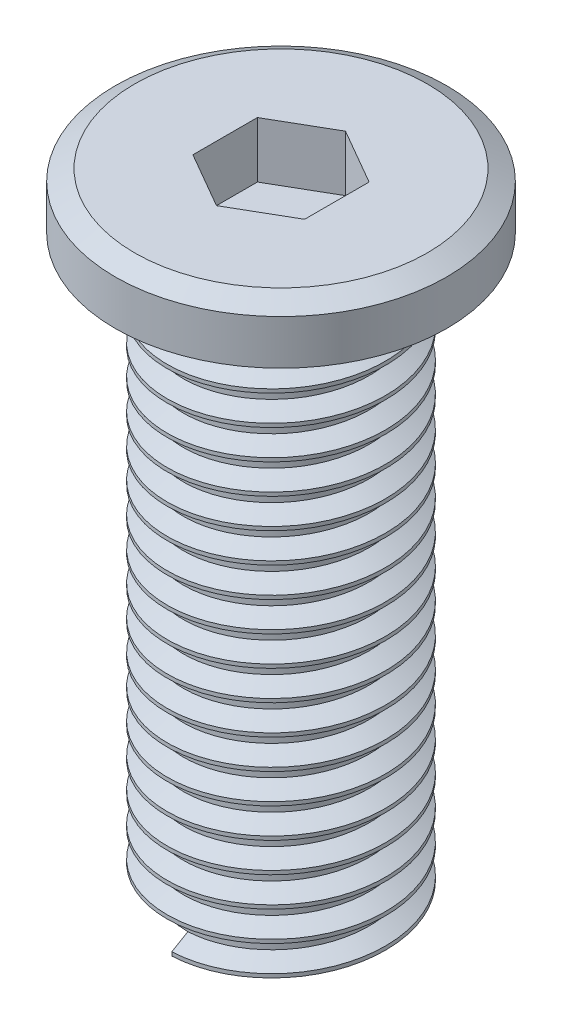
from build123d import *
from build123d.topology import SkipClean

# Parameters (mm, degrees)
SKETCH1_R           = 4.45
BOSS_EXTRUDE1_DEPTH = 1.5
CHAMFER2_SIZE       = 0.3
CHAMFER2_SIZE2      = 0.519615242
CUT_EXTRUDE1_DEPTH  = 3
SKETCH3_R           = 2.5
BOSS_EXTRUDE2_DEPTH = 15
THREAD1_PITCH       = 0.8


with BuildPart() as part:
    # Sketch1 → Boss-Extrude1 (new body)
    with BuildSketch(Plane(origin=(0, 0, 0), x_dir=(1, 0, 0), z_dir=(0, 1, 0))):
        with Locations(Location((0, 0, 0), (0, 0, 270))):
            Circle(SKETCH1_R)
    extrude(amount=BOSS_EXTRUDE1_DEPTH)

    # Chamfer2
    chamfer2_edges = [part.edges().sort_by_distance(p)[0] for p in [
        (0, 1.5, -4.45),
    ]]
    chamfer2_side = [part.faces().sort_by_distance(p)[0] for p in [
        (0, 0.75, -4.45),
    ]]
    chamfer(chamfer2_edges, length=CHAMFER2_SIZE, length2=CHAMFER2_SIZE2, reference=chamfer2_side[0])

    # Sketch8 → Cut-Extrude1 (cut)
    with BuildSketch(Plane(origin=(0, 1.5, 0), x_dir=(1, 0, 0), z_dir=(0, 1, 0))):
        Polygon((0, 1.732050808), (-1.5, 0.866025404), (-1.5, -0.866025404), (0, -1.732050808), (1.5, -0.866025404), (1.5, 0.866025404), align=None)
    extrude(amount=-CUT_EXTRUDE1_DEPTH, mode=Mode.SUBTRACT)

    # Sketch3 → Boss-Extrude2 (add)
    with BuildSketch(Plane.XZ):
        with Locations(Location((0, 0, 0), (0, 0, 90))):
            Circle(SKETCH3_R)
    extrude(amount=BOSS_EXTRUDE2_DEPTH)

    # Thread1: the profile of Thread Profile2 profile screwed along a right-hand helix of 18.75 turns, 8 arcs to a turn; built about Z, then put on its axis
    with SkipClean():  # the faces are left unmerged after this step: merging them gives an invalid solid
        thread1_z = Axis((0, 0, 0), (0, 0, 1))
        thread1_corners = [(2.4997, 0, -0.000173205), (2.9330127, 0, 0.249999999), (2.9330127, 0, 0.349999999), (2.4997, 0, 0.600173203)]
        with BuildLine(mode=Mode.PRIVATE) as thread1_profile:
            Line(thread1_corners[0], thread1_corners[1])
            Line(thread1_corners[1], thread1_corners[2])
            Line(thread1_corners[2], thread1_corners[3])
            Line(thread1_corners[3], thread1_corners[0])
        thread1_cap = Face(thread1_profile.wire())
        thread1_turn_angles = [0, 22.5, 45, 67.5, 90, 112.5, 135, 157.5, 180, 202.5, 225, 247.5, 270, 292.5, 315, 337.5, 360]
        thread1_turn_weights = [1, 0.9238795325112867, 1, 0.9238795325112867, 1, 0.9238795325112867, 1, 0.9238795325112867, 1, 0.9238795325112867, 1, 0.9238795325112867, 1, 0.9238795325112867, 1, 0.9238795325112867, 1]
        thread1_turn_rails = [Edge.make_bspline([Vector(p[0], p[1], 0).rotate(thread1_z, thread1_turn_angles[k]) / thread1_turn_weights[k] + Vector(0, 0, p[2] + THREAD1_PITCH * thread1_turn_angles[k] / 360) for k in range(17)], [0, 0, 0, 1, 1, 2, 2, 3, 3, 4, 4, 5, 5, 6, 6, 7, 7, 8, 8, 8], 2, thread1_turn_weights) for p in thread1_corners]
        thread1_turn_sides = [Face.make_surface_from_curves(thread1_turn_rails[p[0]], thread1_turn_rails[p[1]]) for p in [(0, 1), (1, 2), (2, 3), (3, 0)]]
        thread1_last_angles = [6480, 6502.5, 6525, 6547.5, 6570, 6592.5, 6615, 6637.5, 6660, 6682.5, 6705, 6727.5, 6750]
        thread1_last_weights = [1, 0.9238795325112867, 1, 0.9238795325112867, 1, 0.9238795325112867, 1, 0.9238795325112867, 1, 0.9238795325112867, 1, 0.9238795325112867, 1]
        thread1_last_rails = [Edge.make_bspline([Vector(p[0], p[1], 0).rotate(thread1_z, thread1_last_angles[k]) / thread1_last_weights[k] + Vector(0, 0, p[2] + THREAD1_PITCH * thread1_last_angles[k] / 360) for k in range(13)], [0, 0, 0, 1, 1, 2, 2, 3, 3, 4, 4, 5, 5, 6, 6, 6], 2, thread1_last_weights) for p in thread1_corners]
        thread1_last_sides = [Face.make_surface_from_curves(thread1_last_rails[p[0]], thread1_last_rails[p[1]]) for p in [(0, 1), (1, 2), (2, 3), (3, 0)]]
        thread1 = Plane(origin=(0, 0, 0), x_dir=(-1, 0, 0), z_dir=(0, -1, 0)) * Solid(Shell([*[p.moved(Location((0, 0, THREAD1_PITCH * i))) for i in range(18) for p in thread1_turn_sides], *thread1_last_sides, thread1_cap, thread1_cap.rotate(thread1_z, 6750).moved(Location((0, 0, THREAD1_PITCH * 6750 / 360)))]))
        add(thread1)


solid = part.part
